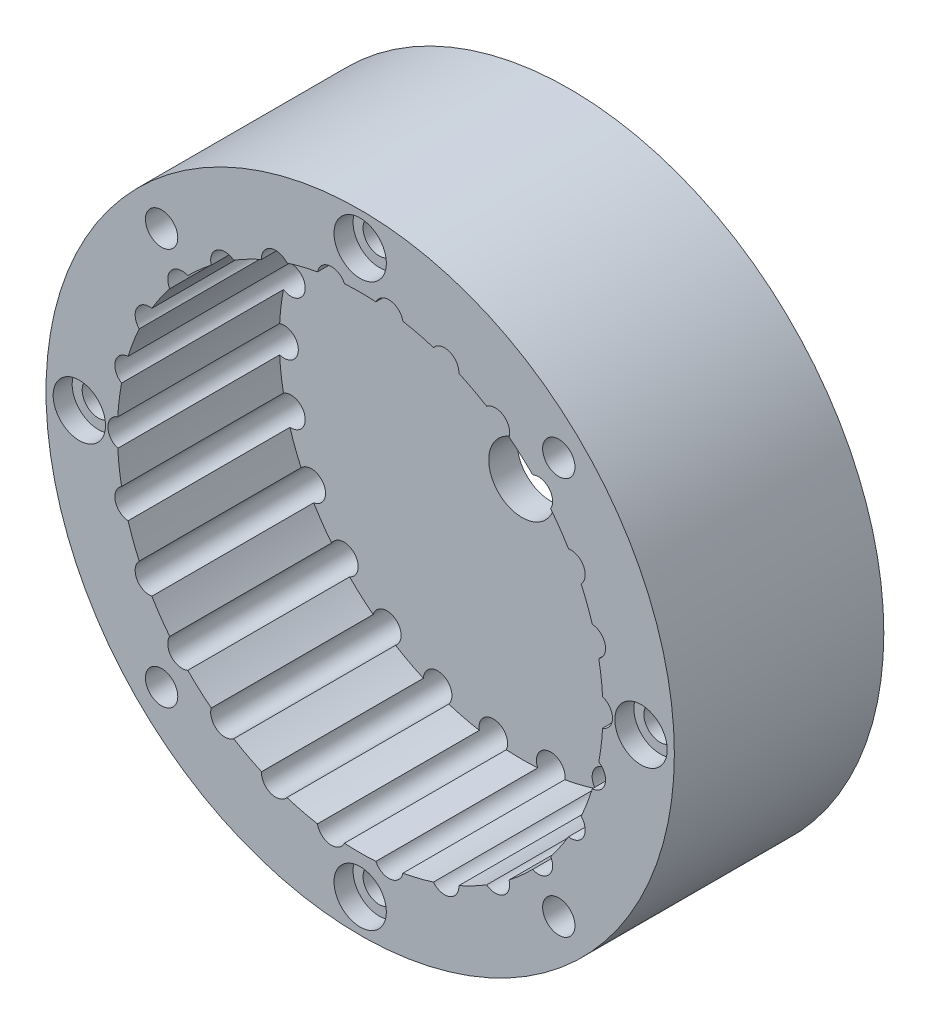
from build123d import *

# Parameters (mm, degrees)
SKETCH1_R               = 33
SKETCH1_R_2             = 25.5
BOSS_EXTRUDE2_DEPTH     = 17
BOSS_EXTRUDE3_START     = -5
SKETCH1_3_R             = 33
BOSS_EXTRUDE3_DEPTH     = 5
CUT_EXTRUDE4_DEPTH      = 50.668903753
CUT_EXTRUDE4_DEPTH_BACK = 3
SKETCH1_5_R             = 1.5
CUT_EXTRUDE6_DEPTH      = 50.668903753
CUT_EXTRUDE6_DEPTH_BACK = 50.668903753
SKETCH3_R               = 1.7
SKETCH3_R_2             = 3.5
SKETCH4_R               = 10
CUT_EXTRUDE7_DEPTH      = 2
SKETCH6_R               = 1.7
CUT_EXTRUDE8_DEPTH      = 10
SKETCH7_R               = 2.75
CUT_EXTRUDE9_DEPTH      = 2


with BuildPart() as part:
    # Sketch1 → Boss-Extrude2 (new body)
    with BuildSketch(Plane.XY):
        Circle(SKETCH1_R)
        Circle(SKETCH1_R_2, mode=Mode.SUBTRACT)
    extrude(amount=BOSS_EXTRUDE2_DEPTH)

    # Sketch1<3> → Boss-Extrude3 (add)
    with BuildSketch(Plane.XY.offset(BOSS_EXTRUDE3_START)):
        Circle(SKETCH1_3_R)
    extrude(amount=BOSS_EXTRUDE3_DEPTH)

    # Sketch1<5> → Cut-Extrude4 (cut, two sides: drawn at the far end of the back side and taken through both)
    with BuildSketch(Plane.XY.offset(-CUT_EXTRUDE4_DEPTH_BACK)):
        with Locations((25, 0)):
            Circle(SKETCH1_5_R)
        with Locations((24.273545436, -5.982891607)):
            Circle(SKETCH1_5_R)
        with Locations((22.136400641, -11.618079301)):
            Circle(SKETCH1_5_R)
        with Locations((18.712768704, -16.578066456)):
            Circle(SKETCH1_5_R)
        with Locations((14.201618668, -20.574596647)):
            Circle(SKETCH1_5_R)
        with Locations((8.865122176, -23.375406067)):
            Circle(SKETCH1_5_R)
        with Locations((3.013417006, -24.817721852)):
            Circle(SKETCH1_5_R)
        with Locations((-3.013417006, -24.817721852)):
            Circle(SKETCH1_5_R)
        with Locations((-8.865122176, -23.375406067)):
            Circle(SKETCH1_5_R)
        with Locations((-14.201618668, -20.574596647)):
            Circle(SKETCH1_5_R)
        with Locations((-18.712768704, -16.578066456)):
            Circle(SKETCH1_5_R)
        with Locations((-22.136400641, -11.618079301)):
            Circle(SKETCH1_5_R)
        with Locations((-24.273545436, -5.982891607)):
            Circle(SKETCH1_5_R)
        with Locations((-25, 0)):
            Circle(SKETCH1_5_R)
        with Locations((-24.273545436, 5.982891607)):
            Circle(SKETCH1_5_R)
        with Locations((-22.136400641, 11.618079301)):
            Circle(SKETCH1_5_R)
        with Locations((-18.712768704, 16.578066456)):
            Circle(SKETCH1_5_R)
        with Locations((-14.201618668, 20.574596647)):
            Circle(SKETCH1_5_R)
        with Locations((-8.865122176, 23.375406067)):
            Circle(SKETCH1_5_R)
        with Locations((-3.013417006, 24.817721852)):
            Circle(SKETCH1_5_R)
        with Locations((3.013417006, 24.817721852)):
            Circle(SKETCH1_5_R)
        with Locations((8.865122176, 23.375406067)):
            Circle(SKETCH1_5_R)
        with Locations((14.201618668, 20.574596647)):
            Circle(SKETCH1_5_R)
        with Locations((18.712768704, 16.578066456)):
            Circle(SKETCH1_5_R)
        with Locations((22.136400641, 11.618079301)):
            Circle(SKETCH1_5_R)
        with Locations((24.273545436, 5.982891607)):
            Circle(SKETCH1_5_R)
    extrude(amount=CUT_EXTRUDE4_DEPTH + CUT_EXTRUDE4_DEPTH_BACK, mode=Mode.SUBTRACT)

    # Sketch3 → Cut-Extrude6 (cut, two sides: drawn at the far end of the back side and taken through both)
    with BuildSketch(Plane.XY.offset(-CUT_EXTRUDE6_DEPTH_BACK)):
        with Locations((0, 29.5)):
            Circle(SKETCH3_R)
        with Locations((29.5, 0)):
            Circle(SKETCH3_R)
        with Locations((0, -29.5)):
            Circle(SKETCH3_R)
        with Locations((-29.5, 0)):
            Circle(SKETCH3_R)
        Circle(SKETCH3_R_2)
    extrude(amount=CUT_EXTRUDE6_DEPTH + CUT_EXTRUDE6_DEPTH_BACK, mode=Mode.SUBTRACT)

    # Sketch4 → Cut-Extrude7 (cut)
    with BuildSketch(Plane(origin=(0, 0, -5), x_dir=(-1, 0, 0), z_dir=(0, 0, -1))):
        Circle(SKETCH4_R)
    extrude(amount=-CUT_EXTRUDE7_DEPTH, mode=Mode.SUBTRACT)

    # Sketch6 → Cut-Extrude8 (cut)
    with BuildSketch(Plane.XY.offset(17)):
        with Locations((-20.859650045, 20.859650045)):
            Circle(SKETCH6_R)
        with Locations((20.859650045, 20.859650045)):
            Circle(SKETCH6_R)
        with Locations((20.859650045, -20.859650045)):
            Circle(SKETCH6_R)
        with Locations((-20.859650045, -20.859650045)):
            Circle(SKETCH6_R)
    extrude(amount=-CUT_EXTRUDE8_DEPTH, mode=Mode.SUBTRACT)

    # Sketch7 → Cut-Extrude9 (cut)
    with BuildSketch(Plane.XY.offset(17)):
        with Locations((0, 29.5)):
            Circle(SKETCH7_R)
        with Locations((29.5, 0)):
            Circle(SKETCH7_R)
        with Locations((0, -29.5)):
            Circle(SKETCH7_R)
        with Locations((-29.5, 0)):
            Circle(SKETCH7_R)
    extrude(amount=-CUT_EXTRUDE9_DEPTH, mode=Mode.SUBTRACT)


solid = part.part
